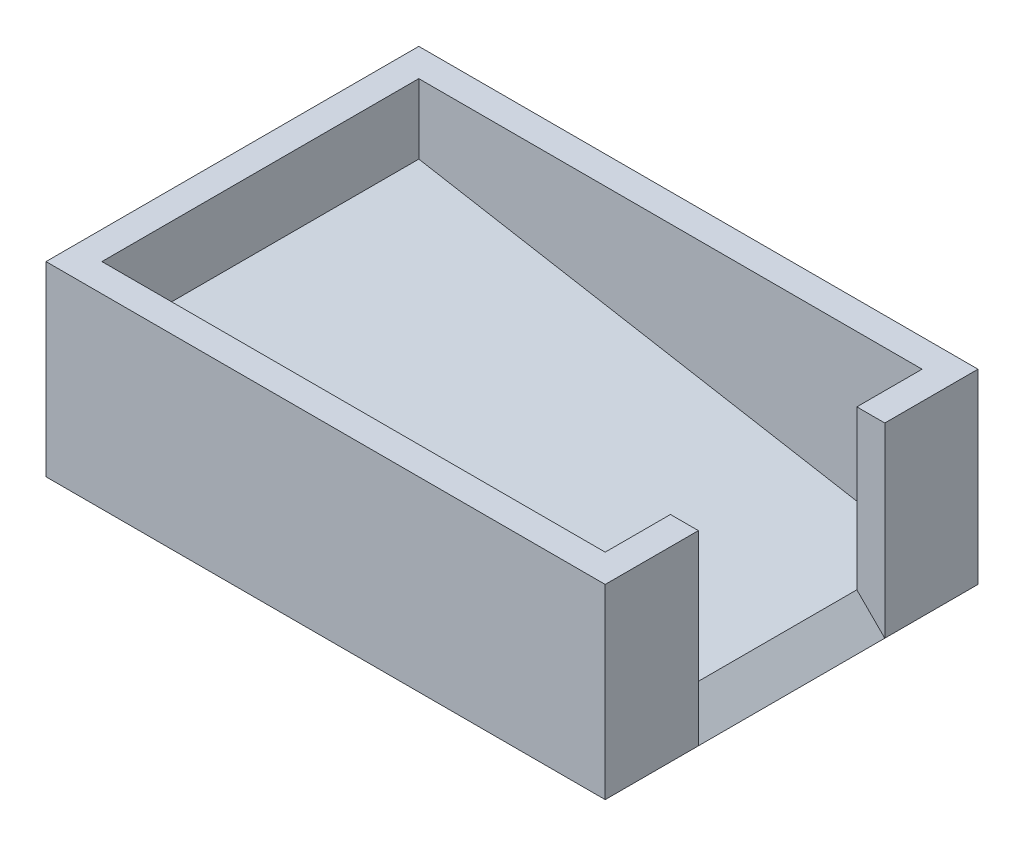
from build123d import *

# Parameters (mm, degrees)
SKETCH1_W           = 60
SKETCH1_H           = 40
SKETCH1_W_2         = 19
SKETCH1_H_2         = 15
BOSS_EXTRUDE1_DEPTH = 20
SHELL2_T            = -3
SKETCH1_3_W         = 19
SKETCH1_3_H         = 15
BOSS_EXTRUDE2_DEPTH = 3
SKETCH2_W           = 20
SKETCH2_H           = 17
CUT_EXTRUDE1_DEPTH  = 3
CHAMFER1_SIZE       = 3
BOSS_EXTRUDE3_REACH = 53.662


with BuildPart() as part:
    # Sketch1 → Boss-Extrude1 (new body)
    # profile 1 of 2: a face of its own
    with BuildSketch(Plane(origin=(0, 0, 0), x_dir=(1, 0, 0), z_dir=(0, 1, 0))):
        Rectangle(SKETCH1_W, SKETCH1_H)
        Rectangle(SKETCH1_W_2, SKETCH1_H_2, mode=Mode.SUBTRACT)
    # profile 2 of 2: a face of its own
    with BuildSketch(Plane(origin=(0, 0, 0), x_dir=(1, 0, 0), z_dir=(0, 1, 0))):
        Rectangle(SKETCH1_W_2, SKETCH1_H_2)
    extrude(amount=BOSS_EXTRUDE1_DEPTH)

    # Shell2
    shell2_openings = [part.faces().sort_by_distance(p)[0] for p in [
        (0, 20, 0),
    ]]
    offset(amount=SHELL2_T, openings=shell2_openings, kind=Kind.INTERSECTION)

    # Sketch1<3> → Boss-Extrude2 (add)
    with BuildSketch(Plane(origin=(0, 0, 0), x_dir=(1, 0, 0), z_dir=(0, 1, 0))):
        Rectangle(SKETCH1_3_W, SKETCH1_3_H)
    extrude(amount=-BOSS_EXTRUDE2_DEPTH)

    # Sketch2 → Cut-Extrude1 (cut)
    with BuildSketch(Plane(origin=(30, 0, 0), x_dir=(0, 0, -1), z_dir=(1, 0, 0))):
        with Locations((0, 11.5)):
            Rectangle(SKETCH2_W, SKETCH2_H)
    extrude(amount=-CUT_EXTRUDE1_DEPTH, mode=Mode.SUBTRACT)

    # Chamfer1
    chamfer1_edges = [part.edges().sort_by_distance(p)[0] for p in [
        (30, 3, 0),
    ]]
    chamfer(chamfer1_edges, length=CHAMFER1_SIZE - 0.0001)  # a hair under: the kernel refuses the full size

    # Sketch3 → Boss-Extrude3 (add, up to next)
    with BuildSketch(Plane.XY.offset(-17), mode=Mode.PRIVATE) as boss_extrude3_sk1:
        Polygon((-27, 3), (27, 3), (-27, 12.521656958), align=None)
    boss_extrude3_tool1 = extrude(boss_extrude3_sk1.sketch, amount=BOSS_EXTRUDE3_REACH, mode=Mode.PRIVATE) - part.part
    add(boss_extrude3_tool1.solids().sort_by_distance((-9, 6.173886, -17))[0])


solid = part.part
